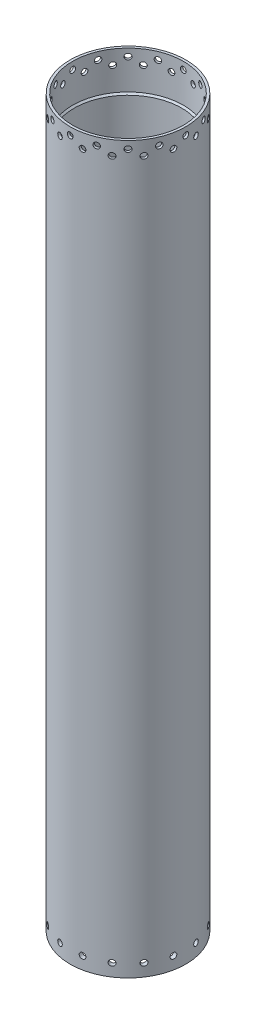
from build123d import *

# Parameters (mm, degrees)
SFAZOWANIE1_SIZE           = 2
SZKIC6_R                   = 3.5
WYTNIJ_WYCI_GNI_CIE2_DEPTH = 10
SZYK_KO_OWY2_COUNT         = 16
SZKIC4_R                   = 3.5
WYTNIJ_WYCI_GNI_CIE4_DEPTH = 10
SZYK_KO_OWY3_COUNT         = 16
SZKIC7_R                   = 3.5
WYTNIJ_WYCI_GNI_CIE5_DEPTH = 10
SZYK_KO_OWY4_COUNT         = 16


with BuildPart() as part:
    # Szkic1 → Obrót1 (revolve)
    with BuildSketch(Plane.XY, mode=Mode.PRIVATE) as obr_t1_sk:
        Polygon((70, -438.5), (70, 438.5), (67, 438.5), (67, 390.5), (65, 390.5), (65, -438.5), align=None)
    revolve(obr_t1_sk.sketch.rotate(Axis((0, 552.439415296, 0), (0, -1, 0)), 90), axis=Axis((0, 552.439415296, 0), (0, -1, 0)))

    # Sfazowanie1
    sfazowanie1_edges = [part.edges().sort_by_distance(p)[0] for p in [
        (0, 390.5, -67),
    ]]
    chamfer(sfazowanie1_edges, length=SFAZOWANIE1_SIZE - 0.0001)  # a hair under: the kernel refuses the full size

    # Szkic6 → Wytnij-wyciągnięcie2 (cut)
    with BuildSketch(Plane(origin=(-13.656322541, 0, 68.654969628), x_dir=(0, 1, 0), z_dir=(-0.1950903220161221, 0, 0.9807852804032318))):
        with Locations(Location((421.5, 0, 0), (0, 0, 270))):
            Circle(SZKIC6_R)
    wytnij_wyci_gni_cie2 = extrude(amount=-WYTNIJ_WYCI_GNI_CIE2_DEPTH, mode=Mode.SUBTRACT)

    # Szyk kołowy2: Wytnij-wyciągnięcie2 ×16 about axis
    szyk_ko_owy2_axis = Axis((0, 552.439415296, 0), (0, 1, 0))
    for i in range(1, SZYK_KO_OWY2_COUNT):
        add(wytnij_wyci_gni_cie2.rotate(szyk_ko_owy2_axis, i * 360 / SZYK_KO_OWY2_COUNT), mode=Mode.SUBTRACT)

    # Szkic4 → Wytnij-wyciągnięcie4 (cut)
    with BuildSketch(Plane.XY.offset(70)):
        with Locations(Location((0, 429.5, 0), (0, 0, 270))):
            Circle(SZKIC4_R)
    wytnij_wyci_gni_cie4 = extrude(amount=-WYTNIJ_WYCI_GNI_CIE4_DEPTH, mode=Mode.SUBTRACT)

    # Szyk kołowy3: Wytnij-wyciągnięcie4 ×16 about axis
    szyk_ko_owy3_axis = Axis((0, 552.439415296, 0), (0, 1, 0))
    for i in range(1, SZYK_KO_OWY3_COUNT):
        add(wytnij_wyci_gni_cie4.rotate(szyk_ko_owy3_axis, i * 360 / SZYK_KO_OWY3_COUNT), mode=Mode.SUBTRACT)

    # Szkic7 → Wytnij-wyciągnięcie5 (cut)
    with BuildSketch(Plane(origin=(-13.656322541, 0, 68.654969628), x_dir=(0, 1, 0), z_dir=(-0.1950903220161221, 0, 0.9807852804032318))):
        with Locations(Location((-423.5, 0, 0), (0, 0, 270))):
            Circle(SZKIC7_R)
    wytnij_wyci_gni_cie5 = extrude(amount=-WYTNIJ_WYCI_GNI_CIE5_DEPTH, mode=Mode.SUBTRACT)

    # Szyk kołowy4: Wytnij-wyciągnięcie5 ×16 about axis
    szyk_ko_owy4_axis = Axis((0, 552.439415296, 0), (0, 1, 0))
    for i in range(1, SZYK_KO_OWY4_COUNT):
        add(wytnij_wyci_gni_cie5.rotate(szyk_ko_owy4_axis, i * 360 / SZYK_KO_OWY4_COUNT), mode=Mode.SUBTRACT)


solid = part.part
